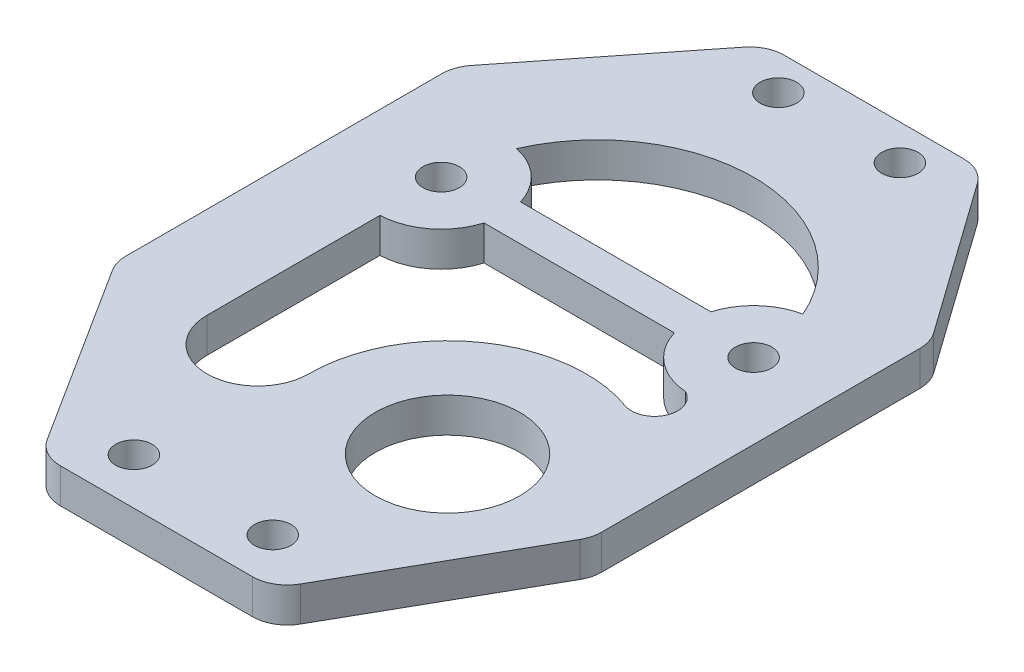
from build123d import *

# Parameters (mm, degrees)
SKETCH1_R          = 6.25
SKETCH1_R_2        = 1.575
BASE_FLANGE1_DEPTH = 3
L_EK1_SCALE        = 2


# Sheet-metal steps are written as plain solids
with BuildPart() as part:
    # Sketch1 → Base-Flange1 (new body)
    with BuildSketch(Plane(origin=(0, 0, 0), x_dir=(1, 0, 0), z_dir=(0, 1, 0))):
        with BuildLine():
            Line((19.609421573, -14.059417906), (10.862109445, -29.480175346))
            ThreePointArc((10.862109445, -29.480175346), (9.762567662, -30.59234701), (8.252687872, -31))
            Line((8.252687872, -31), (-8.352599575, -31))
            ThreePointArc((-8.352599575, -31), (-9.796606082, -30.629609326), (-10.884048227, -29.609896806))
            Line((-10.884048227, -29.609896806), (-20.742852548, -14.107625594))
            ThreePointArc((-20.742852548, -14.107625594), (-21.091885276, -13.336076582), (-21.211403896, -12.497728788))
            Line((-21.211403896, -12.497728788), (-21.211403896, 14.839305313))
            ThreePointArc((-21.211403896, 14.839305313), (-21.044943633, 15.824725306), (-20.564035521, 16.700789784))
            Line((-20.564035521, 16.700789784), (-10.150833328, 29.861484472))
            ThreePointArc((-10.150833328, 29.861484472), (-9.105019706, 30.700412322), (-7.798201703, 31))
            Line((-7.798201703, 31), (7.702138241, 31))
            ThreePointArc((7.702138241, 31), (9.077698333, 30.666052219), (10.147014932, 29.738556288))
            Line((10.147014932, 29.738556288), (19.444876691, 16.663267527))
            ThreePointArc((19.444876691, 16.663267527), (19.857851472, 15.837226972), (20, 14.924711239))
            Line((20, 14.924711239), (20, -12.57924256))
            ThreePointArc((20, -12.57924256), (19.900712388, -13.344662472), (19.609421573, -14.059417906))
        make_face()
        with Locations(Location((7.5, -13.4, 0), (0, 0, 270))):
            Circle(SKETCH1_R, mode=Mode.SUBTRACT)
        with Locations(Location((6, -27, 0), (0, 0, 270))):
            Circle(SKETCH1_R_2, mode=Mode.SUBTRACT)
        with Locations(Location((-6, -27, 0), (0, 0, 270))):
            Circle(SKETCH1_R_2, mode=Mode.SUBTRACT)
        with Locations(Location((5.25, 27.940782939, 0), (0, 0, 270))):
            Circle(SKETCH1_R_2, mode=Mode.SUBTRACT)
        with Locations(Location((-5.25, 27.940782939, 0), (0, 0, 270))):
            Circle(SKETCH1_R_2, mode=Mode.SUBTRACT)
        with Locations(Location((13.5, 7.05, 0), (0, 0, 270))):
            Circle(SKETCH1_R_2, mode=Mode.SUBTRACT)
        with Locations(Location((-13.5, 7.05, 0), (0, 0, 270))):
            Circle(SKETCH1_R_2, mode=Mode.SUBTRACT)
        with BuildLine():
            Line((-13.281403896, 0), (-13.281403896, 1.54698652))
            ThreePointArc((-13.281403896, 1.54698652), (-10.122330587, 2.700024029), (-8.222660082, 5.475))
            Line((-8.222660082, 5.475), (8.230334451, 5.475))
            ThreePointArc((8.230334451, 5.475), (10.061414817, 2.757432943), (13.113110627, 1.563624456))
            ThreePointArc((13.113110627, 1.563624456), (14.07117407, -0.953003234), (11.655254401, -2.142386538))
            ThreePointArc((11.655254401, -2.142386538), (0.639353267, -3.554619032), (-4.5, -13.4))
            ThreePointArc((-4.5, -13.4), (-8.890701948, -17.790701948), (-13.281403896, -13.4))
            Line((-13.281403896, -13.4), (-13.281403896, 0))
        make_face(mode=Mode.SUBTRACT)
        with BuildLine():
            Line((-8.222660082, 8.625), (8.230334451, 8.625))
            ThreePointArc((8.230334451, 8.625), (9.780248168, 11.101351171), (12.37962963, 12.434679214))
            ThreePointArc((12.37962963, 12.434679214), (0.003755557, 20.549999478), (-12.376631792, 12.441566144))
            ThreePointArc((-12.376631792, 12.441566144), (-9.773901449, 11.105506282), (-8.222660082, 8.625))
        make_face(mode=Mode.SUBTRACT)
    extrude(amount=BASE_FLANGE1_DEPTH)


with BuildPart() as part_1:
    # Ölçek1: scaled about (-0.5271359, 1.5, 0.12162837)
    add(part.part.scale(L_EK1_SCALE).moved(Location((0.5271359, -1.5, -0.12162837))))


solid = part_1.part
